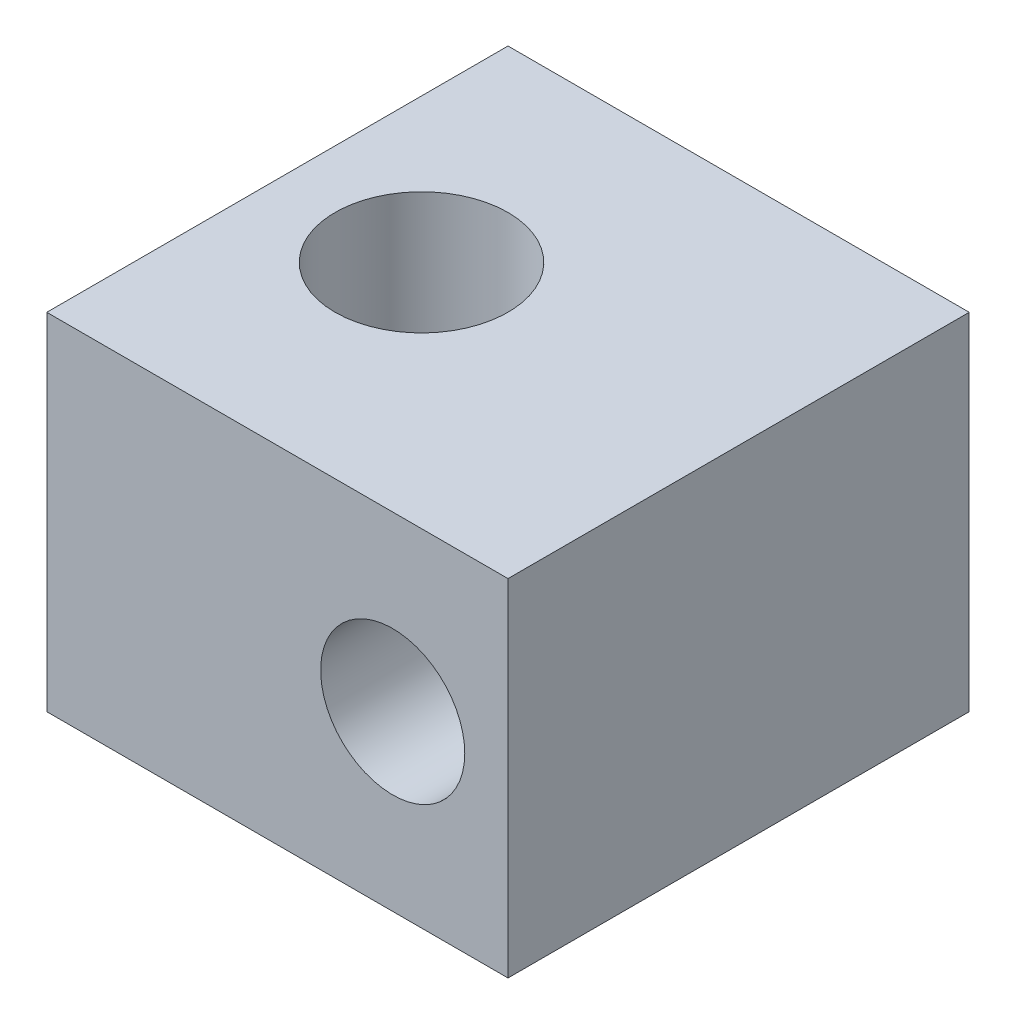
from build123d import *

# Parameters (mm, degrees)
SKICA1_W                 = 16
SKICA1_H                 = 16
SKICA1_R                 = 3
P_IDAT_VYSUNUT_M1_DEPTH  = 12
SKICA2_R                 = 2.5
ODEBRAT_VYSUNUT_M1_DEPTH = 22


with BuildPart() as part:
    # Skica1 → Přidat vysunutím1 (new body)
    with BuildSketch(Plane(origin=(0, 0, 0), x_dir=(1, 0, 0), z_dir=(0, 1, 0))):
        Rectangle(SKICA1_W, SKICA1_H)
        with Locations((-3, 0)):
            Circle(SKICA1_R, mode=Mode.SUBTRACT)
    extrude(amount=P_IDAT_VYSUNUT_M1_DEPTH)

    # Skica2 → Odebrat vysunutím1 (cut)
    with BuildSketch(Plane.XY.offset(8)):
        with Locations((4, 6)):
            Circle(SKICA2_R)
    extrude(amount=-ODEBRAT_VYSUNUT_M1_DEPTH, mode=Mode.SUBTRACT)


solid = part.part
